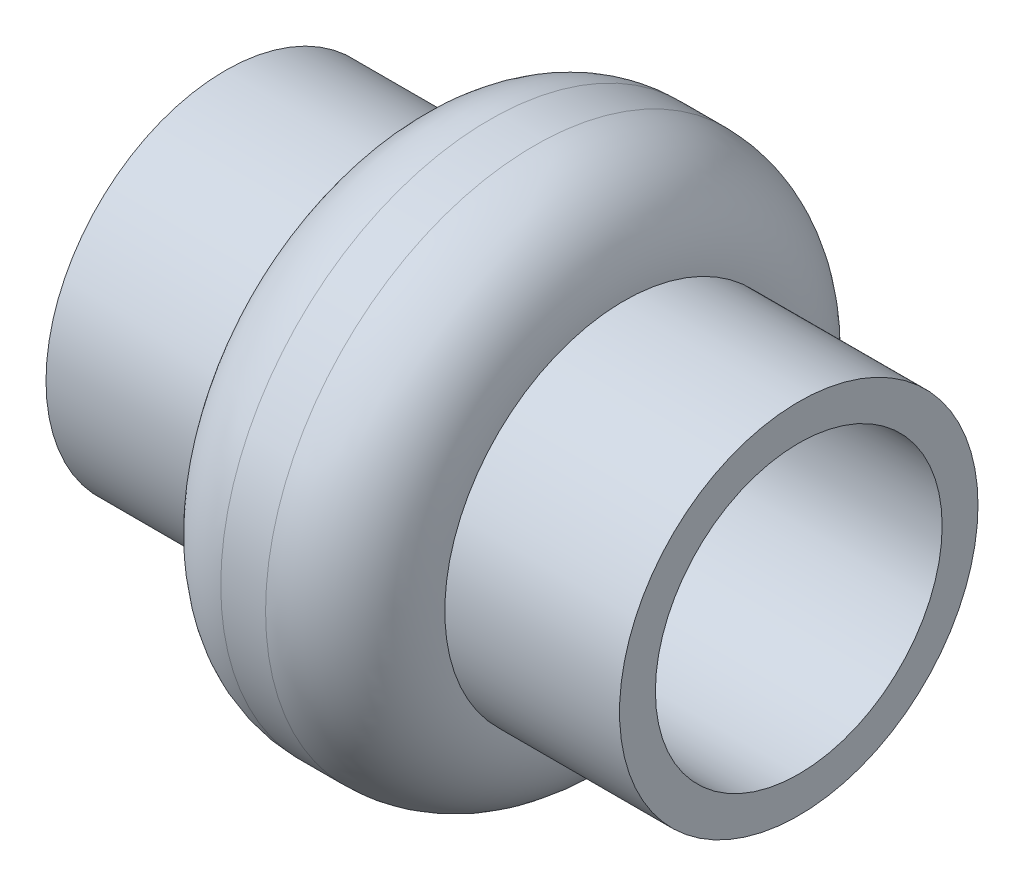
from build123d import *

# Parameters (mm, degrees)
SKETCH1_R           = 3
BOSS_EXTRUDE1_DEPTH = 1.25
SKETCH2_R           = 2
BOSS_EXTRUDE2_DEPTH = 1.95
BOSS_EXTRUDE8_START = 1.95
SKETCH3_R           = 2
BOSS_EXTRUDE8_DEPTH = 1.95
SKETCH4_R           = 1.6
CUT_EXTRUDE1_DEPTH  = 8.678541528
FILLET1_R           = 1


with BuildPart() as part:
    # Sketch1 → Boss-Extrude1 (new, symmetric)
    with BuildSketch(Plane(origin=(0, 0, 0), x_dir=(0, 0, -1), z_dir=(1, 0, 0))):
        Circle(SKETCH1_R)
    extrude(amount=BOSS_EXTRUDE1_DEPTH, both=True)

    # Sketch2 → Boss-Extrude2 (add)
    with BuildSketch(Plane(origin=(1.25, 0, 0), x_dir=(0, 0, -1), z_dir=(1, 0, 0))):
        Circle(SKETCH2_R)
    extrude(amount=BOSS_EXTRUDE2_DEPTH)

    # Sketch3 → Boss-Extrude8 (add)
    with BuildSketch(Plane.ZY.offset(1.25).offset(BOSS_EXTRUDE8_START)):
        with Locations(Location((0, 0, 0), (0, 0, 180))):
            Circle(SKETCH3_R)
    extrude(amount=-BOSS_EXTRUDE8_DEPTH)

    # Sketch4 → Cut-Extrude1 (cut, through all)
    with BuildSketch(Plane(origin=(3.2, 0, 0), x_dir=(0, 0, -1), z_dir=(1, 0, 0))):
        Circle(SKETCH4_R)
    extrude(amount=-CUT_EXTRUDE1_DEPTH, mode=Mode.SUBTRACT)

    # Fillet1
    fillet1_edges = [part.edges().sort_by_distance(p)[0] for p in [
        (-1.25, 0, 3),
        (1.25, 0, 3),
    ]]
    fillet(fillet1_edges, radius=FILLET1_R - 0.0001)  # a hair under: the kernel refuses the full size


solid = part.part
